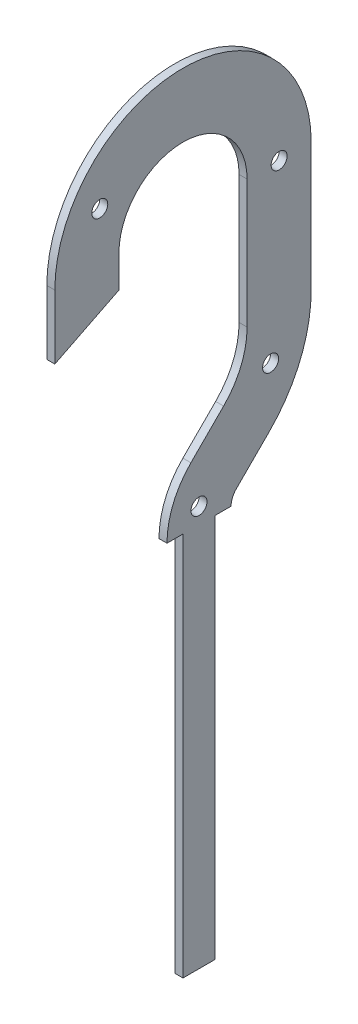
from build123d import *

# Parameters (mm, degrees)
BOSS_EXTRUDE1_DEPTH = 3.175
SKETCH2_R           = 3.175
CUT_EXTRUDE1_DEPTH  = 267.416286067


with BuildPart() as part:
    # Sketch1 → Boss-Extrude1 (new body)
    with BuildSketch(Plane(origin=(0, 0, 0), x_dir=(0, 0, -1), z_dir=(1, 0, 0))):
        with BuildLine():
            Line((-50.8, 0), (-50.8, -25.4))
            Line((-50.8, -25.4), (-25.4, -12.7))
            Line((-25.4, -12.7), (-25.4, 0))
            ThreePointArc((-25.4, 0), (0, 25.4), (25.4, 0))
            Line((25.4, 0), (25.4, -50.8))
            ThreePointArc((25.4, -50.8), (22.983175157, -62.950198978), (16.100640303, -73.250640303))
            Line((16.100640303, -73.250640303), (3.130634922, -86.220645683))
            ThreePointArc((3.130634922, -86.220645683), (-3.886063261, -96.721876619), (-6.35, -109.108923092))
            Line((-6.35, -109.108923092), (0, -109.108923092))
            Line((0, -109.108923092), (0, -261.508923092))
            Line((0, -261.508923092), (12.7, -261.508923092))
            Line((12.7, -261.508923092), (12.7, -109.108923092))
            Line((12.7, -109.108923092), (19.05, -109.108923092))
            ThreePointArc((19.05, -109.108923092), (19.580476865, -106.442035801), (21.091147164, -104.181157925))
            Line((21.091147164, -104.181157925), (34.061152545, -91.211152545))
            ThreePointArc((34.061152545, -91.211152545), (46.449715283, -72.67035816), (50.8, -50.8))
            Line((50.8, -50.8), (50.8, 0))
            ThreePointArc((50.8, 0), (0, 50.8), (-50.8, 0))
        make_face()
    extrude(amount=BOSS_EXTRUDE1_DEPTH)

    # Sketch2 → Cut-Extrude1 (cut, through all)
    with BuildSketch(Plane(origin=(3.175, 0, 0), x_dir=(0, 0, -1), z_dir=(1, 0, 0))):
        with Locations((38.1, 0)):
            Circle(SKETCH2_R)
        with Locations((-32.995567884, 19.05)):
            Circle(SKETCH2_R)
        with Locations((34.71644522, -67.810278569)):
            Circle(SKETCH2_R)
        with Locations((6.35, -102.758923092)):
            Circle(SKETCH2_R)
    extrude(amount=-CUT_EXTRUDE1_DEPTH, mode=Mode.SUBTRACT)


solid = part.part
